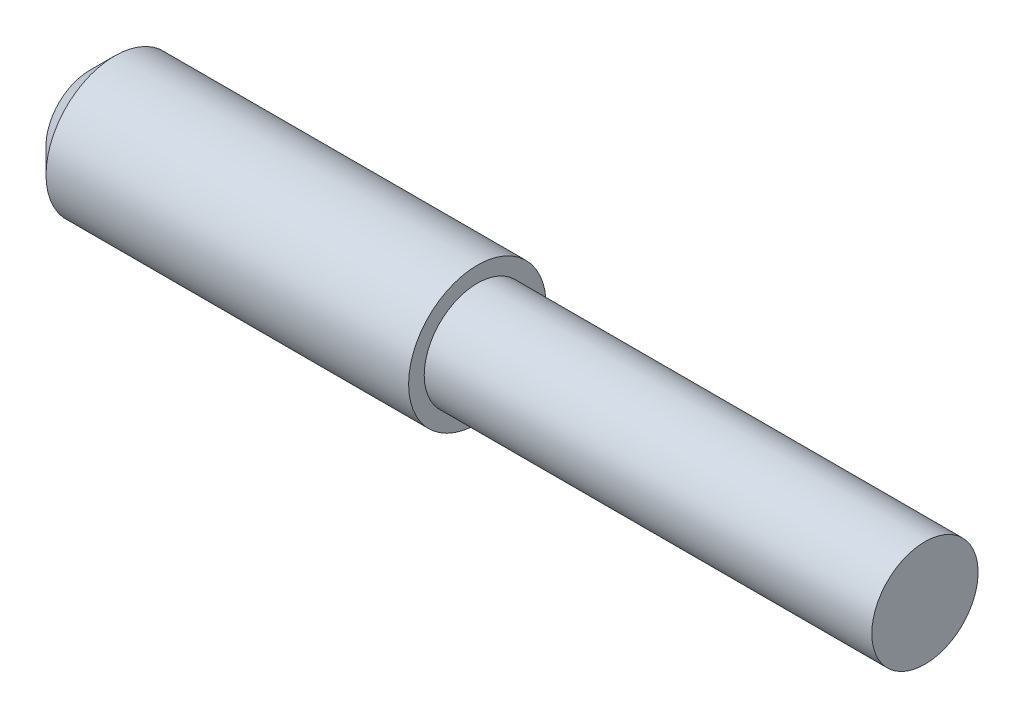
from build123d import *

# Parameters (mm, degrees)
CHAMFER1_SIZE = 1


with BuildPart() as part:
    # Sketch1 → Revolve1 (revolve)
    with BuildSketch(Plane.XY):
        Polygon((0, 2.75), (-15.5, 2.75), (-15.5, 0), (17.9, 0), (17.9, 2.125), (0, 2.125), align=None)
    revolve(axis=Axis((-9.458937198, 0, 0), (1, 0, 0)))

    # Chamfer1
    chamfer1_edges = [part.edges().sort_by_distance(p)[0] for p in [
        (-15.5, -2.75, 0),
    ]]
    chamfer(chamfer1_edges, length=CHAMFER1_SIZE)


solid = part.part
